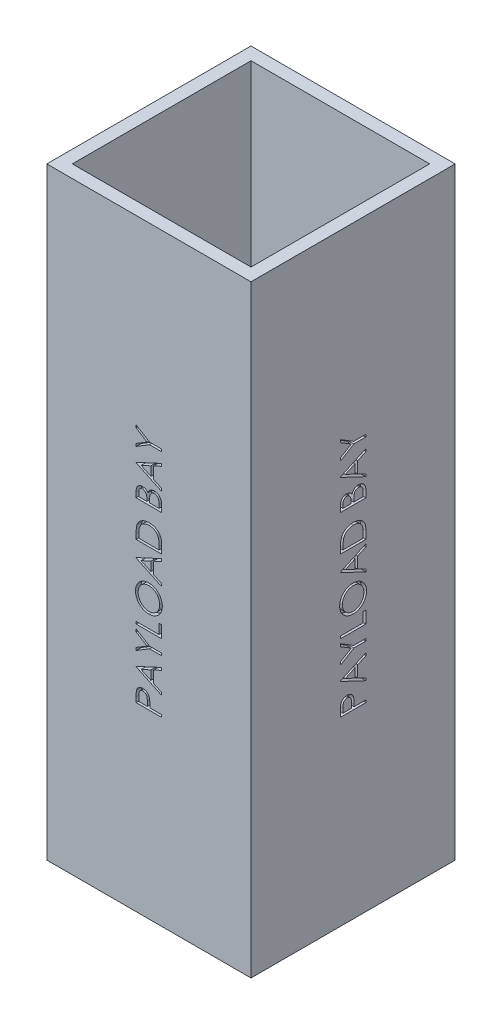
from build123d import *

# Parameters (mm, degrees)
SKETCH1_W           = 101.6
SKETCH1_H           = 101.6
SKETCH1_W_2         = 88.9
SKETCH1_H_2         = 88.9
BOSS_EXTRUDE1_DEPTH = 300
CUT_EXTRUDE1_DEPTH  = 2.54
CIRPATTERN1_COUNT   = 4


with BuildPart() as part:
    # Sketch1 → Boss-Extrude1 (new body)
    with BuildSketch(Plane(origin=(0, 0, 0), x_dir=(1, 0, 0), z_dir=(0, 1, 0))):
        Rectangle(SKETCH1_W, SKETCH1_H)
        Rectangle(SKETCH1_W_2, SKETCH1_H_2, mode=Mode.SUBTRACT)
    extrude(amount=BOSS_EXTRUDE1_DEPTH)

    # Sketch6 → Cut-Extrude1 (cut)
    # profile 1 of 10: a face of its own
    with BuildSketch(Plane.ZY.offset(50.8)):
        with BuildLine():
            Line((-6.35, 90.082051282), (-6.35, 92.572696314))
            add(Edge.make_bspline(
                [(-6.35, 92.572696314), (-6.349811691, 92.744004459), (-6.349450882, 93.072238473), (-6.338511661, 93.542918818), (-6.323900522, 93.970399844), (-6.303646223, 94.353759798), (-6.279710024, 94.694178211), (-6.246138339, 94.990114698), (-6.211085266, 95.243895374), (-6.175447591, 95.395955919), (-6.159194712, 95.465304487)],
                knots=[0, 0, 0, 0, 1.415646017, 2.712440637, 3.8905458, 4.950247383, 5.884950622, 6.709939814, 7.411656543, 8, 8, 8, 8], degree=3))
            add(Edge.make_bspline(
                [(-6.159194712, 95.465304487), (-6.135165553, 95.553091687), (-6.087673454, 95.726597491), (-5.99256869, 95.976620926), (-5.879734333, 96.214446609), (-5.751382729, 96.441136022), (-5.601195819, 96.652560376), (-5.439164902, 96.855767619), (-5.254818851, 97.043584549), (-5.053971996, 97.218555122), (-4.839171698, 97.380275569), (-4.60651531, 97.516149986), (-4.36294889, 97.634954344), (-4.105162168, 97.732225501), (-3.832904869, 97.804560375), (-3.548111823, 97.858261731), (-3.250462794, 97.892503698), (-3.047042823, 97.895772087), (-2.943489583, 97.897435897)],
                knots=[0, 0, 0, 0, 0.999549623, 1.97554611, 2.93413192, 3.889860808, 4.833293765, 5.780583482, 6.742559327, 7.719844669, 8.705620613, 9.691528643, 10.674968152, 11.680406189, 12.713313868, 13.765869198, 14.862690416, 16, 16, 16, 16], degree=3))
            add(Edge.make_bspline(
                [(-2.943489583, 97.897435897), (-2.839067365, 97.895906728), (-2.634758241, 97.892914804), (-2.335862696, 97.857005426), (-2.050227394, 97.808635873), (-1.778485674, 97.734260855), (-1.522251307, 97.636849412), (-1.277608551, 97.522578249), (-1.048719455, 97.384752296), (-0.834753057, 97.226383914), (-0.635508519, 97.050210986), (-0.452429693, 96.856978896), (-0.286588236, 96.647467749), (-0.137612361, 96.422343383), (-0.008956718, 96.179411074), (0.106276931, 95.92235526), (0.20305478, 95.648941618), (0.25396386, 95.459738781), (0.279847756, 95.363541667)],
                knots=[0, 0, 0, 0, 1.121902311, 2.195077645, 3.232258892, 4.234102512, 5.217864754, 6.176164875, 7.132989551, 8.084763148, 9.034132444, 9.988522005, 10.94243251, 11.903244335, 12.886203696, 13.894208494, 14.929344452, 16, 16, 16, 16], degree=3))
            add(Edge.make_bspline(
                [(0.279847756, 95.363541667), (0.296755106, 95.283975863), (0.333808547, 95.109602778), (0.375455577, 94.822445764), (0.409610691, 94.48794002), (0.441484518, 94.107223684), (0.458373661, 93.679408932), (0.47820427, 93.205476968), (0.487561251, 92.683823846), (0.488152728, 92.319987058), (0.488461538, 92.130028045)],
                knots=[0, 0, 0, 0, 0.601372724, 1.317943291, 2.144091499, 3.08771165, 4.142394186, 5.309582461, 6.595334295, 8, 8, 8, 8], degree=3))
            Line((0.488461538, 92.130028045), (0.488461538, 91.221794872))
            Line((0.488461538, 91.221794872), (6.35, 91.221794872))
            Line((6.35, 91.221794872), (6.35, 90.082051282))
            Line((6.35, 90.082051282), (-6.35, 90.082051282))
        make_face()
        with BuildLine():
            Line((-5.047435897, 91.221794872), (-0.814102564, 91.221794872))
            Line((-0.814102564, 91.221794872), (-0.786117788, 93.4453125))
            add(Edge.make_bspline(
                [(-0.786117788, 93.4453125), (-0.786058006, 93.553879847), (-0.785942597, 93.763466872), (-0.800452377, 94.066211014), (-0.816979073, 94.347130601), (-0.841974741, 94.605169257), (-0.874740105, 94.84123239), (-0.915487111, 95.053280991), (-0.959785588, 95.244486591), (-1.033797354, 95.464431594), (-1.147598039, 95.711657023), (-1.313260324, 95.981731934), (-1.527867901, 96.208844847), (-1.768488369, 96.40501689), (-2.035447832, 96.563756171), (-2.322580965, 96.675740401), (-2.62563392, 96.744695668), (-2.832880378, 96.75330752), (-2.938401442, 96.757692308)],
                knots=[0, 0, 0, 0, 1.160746174, 2.240796558, 3.240300023, 4.169675897, 5.012224395, 5.787635701, 6.478238024, 7.109103438, 8.265591281, 9.382545711, 10.479929969, 11.588830844, 12.694575677, 13.785760505, 14.872603606, 16, 16, 16, 16], degree=3))
            add(Edge.make_bspline(
                [(-2.938401442, 96.757692308), (-3.040503948, 96.753110659), (-3.243471094, 96.744002909), (-3.540938354, 96.676309447), (-3.824816581, 96.562553668), (-4.089626181, 96.404878111), (-4.329717186, 96.21346686), (-4.538638533, 95.991169219), (-4.705467251, 95.737416482), (-4.81729303, 95.503335586), (-4.882763075, 95.293719024), (-4.930049703, 95.112545142), (-4.962657093, 94.906933975), (-4.993858298, 94.678839141), (-5.019043897, 94.428550238), (-5.036533738, 94.154476492), (-5.046662216, 93.857530593), (-5.04717176, 93.651390347), (-5.047435897, 93.54453125)],
                knots=[0, 0, 0, 0, 1.120540835, 2.227496496, 3.330685923, 4.466139262, 5.598993257, 6.692710361, 7.80064471, 8.921224235, 9.527843361, 10.209888745, 10.975318552, 11.811557897, 12.738105936, 13.73658638, 14.826690375, 16, 16, 16, 16], degree=3))
            Line((-5.047435897, 93.54453125), (-5.047435897, 91.221794872))
        make_face(mode=Mode.SUBTRACT)
    # profile 2 of 10: a face of its own
    with BuildSketch(Plane.ZY.offset(50.8)):
        Polygon((-6.35, 105.712820513), (6.35, 111.574358974), (6.35, 110.335396635), (2.279487179, 108.457872596), (2.279487179, 102.700641026), (6.35, 100.769691506), (6.35, 99.525641026), (-6.35, 105.55), align=None)
        Polygon((-3.874619391, 105.618689904), (0.976923077, 103.31885016), (0.976923077, 107.857471955), align=None, mode=Mode.SUBTRACT)
    # profile 3 of 10: a face of its own
    with BuildSketch(Plane.ZY.offset(50.8)):
        Polygon((-6.35, 112.551282051), (-6.35, 113.856390224), (-0.89296875, 117.194210737), (-6.35, 120.526943109), (-6.35, 121.832051282), (0.312920673, 117.761538462), (6.35, 117.761538462), (6.35, 116.621794872), (0.312920673, 116.621794872), align=None)
    # profile 4 of 10: a face of its own
    with BuildSketch(Plane.ZY.offset(50.8)):
        Polygon((-6.35, 123.948717949), (-6.35, 125.088461538), (5.047435897, 125.088461538), (5.047435897, 129.973076923), (6.35, 129.973076923), (6.35, 123.948717949), align=None)
    # profile 5 of 10: a face of its own
    with BuildSketch(Plane.ZY.offset(50.8)):
        with BuildLine():
            add(Edge.make_bspline(
                [(-6.675641026, 138.032692308), (-6.669785071, 138.267878789), (-6.658283492, 138.729804442), (-6.567334124, 139.408062537), (-6.41764098, 140.057525074), (-6.206242297, 140.678565423), (-5.932190469, 141.268821615), (-5.599295982, 141.829960687), (-5.205535771, 142.360300963), (-4.756691829, 142.856191897), (-4.26513446, 143.308559312), (-3.738912975, 143.705514067), (-3.184643364, 144.040382863), (-2.60229672, 144.314509446), (-1.99323266, 144.529716981), (-1.354037691, 144.678184212), (-0.688898346, 144.77303121), (-0.235229152, 144.784118924), (-0.005088141, 144.78974359)],
                knots=[0, 0, 0, 0, 1.065064174, 2.09187391, 3.093564831, 4.079973196, 5.057907931, 6.036227367, 7.030399151, 8.044883615, 9.061699972, 10.052012555, 11.025713132, 11.989727027, 12.962874294, 13.945865945, 14.957962116, 16, 16, 16, 16], degree=3))
            add(Edge.make_bspline(
                [(-0.005088141, 144.78974359), (0.223356266, 144.784117031), (0.673646657, 144.773026431), (1.334584132, 144.678107253), (1.969850898, 144.529054513), (2.578031024, 144.317174008), (3.159194899, 144.042837073), (3.71388411, 143.707475299), (4.241511135, 143.311273919), (4.736454933, 142.860827488), (5.189213913, 142.368333696), (5.588564969, 141.844134632), (5.923579539, 141.2898798), (6.200766497, 140.711312922), (6.411489139, 140.103890905), (6.56490218, 139.472033968), (6.658807614, 138.812299547), (6.669968316, 138.362882653), (6.675641026, 138.134455128)],
                knots=[0, 0, 0, 0, 1.043748596, 2.057349401, 3.045489418, 4.02252776, 4.995289225, 5.97782527, 6.980224157, 8.006516136, 9.032559198, 10.034193337, 11.013412982, 11.987833483, 12.961212594, 13.946489799, 14.956251404, 16, 16, 16, 16], degree=3))
            add(Edge.make_bspline(
                [(6.675641026, 138.134455128), (6.670018965, 137.904315456), (6.658936386, 137.450648902), (6.563935289, 136.784671659), (6.415376844, 136.145035274), (6.203071175, 135.533568914), (5.928688652, 134.949931598), (5.594118477, 134.392981869), (5.19712685, 133.864955249), (4.746579565, 133.370229483), (4.256099934, 132.917568107), (3.730558494, 132.522926944), (3.180265837, 132.188281533), (2.603694821, 131.914820298), (2.003632729, 131.698323545), (1.376076825, 131.550623205), (0.724604903, 131.455061322), (0.281037815, 131.444049165), (0.055969551, 131.438461538)],
                knots=[0, 0, 0, 0, 1.053102029, 2.075944431, 3.073151272, 4.055350789, 5.033113405, 6.020478099, 7.024410459, 8.052272461, 9.079885166, 10.07527673, 11.055994387, 12.023226415, 12.992069828, 13.970394897, 14.97016774, 16, 16, 16, 16], degree=3))
            add(Edge.make_bspline(
                [(0.055969551, 131.438461538), (-0.095097562, 131.440401502), (-0.395326011, 131.444256954), (-0.841156245, 131.490672524), (-1.279816632, 131.558024983), (-1.710059786, 131.654551923), (-2.130832502, 131.780795971), (-2.545036699, 131.929756185), (-2.948474782, 132.111692195), (-3.343057946, 132.317361975), (-3.722635205, 132.546911965), (-4.081426835, 132.800461113), (-4.422443595, 133.069103735), (-4.736848437, 133.363610906), (-5.033787705, 133.674276293), (-5.308698135, 134.006139551), (-5.564058671, 134.357175695), (-5.794183909, 134.728895187), (-6.002315626, 135.112138642), (-6.180920628, 135.507205807), (-6.33421348, 135.908731081), (-6.45845876, 136.318595089), (-6.556546433, 136.735709433), (-6.623338831, 137.16098448), (-6.669872784, 137.594081427), (-6.673710006, 137.885859641), (-6.675641026, 138.032692308)],
                knots=[0, 0, 0, 0, 1.037015668, 2.060948919, 3.074880161, 4.083647147, 5.086022904, 6.090072063, 7.104153813, 8.122640571, 9.144368836, 10.147691507, 11.138137339, 12.123020368, 13.103399296, 14.087645067, 15.080126199, 16.082011238, 17.087798457, 18.072939717, 19.057185487, 20.037253025, 21.01195951, 21.997135196, 22.992090687, 24, 24, 24, 24], degree=3))
        make_face()
        with BuildLine():
            add(Edge.make_bspline(
                [(-5.373076923, 138.088661859), (-5.371612874, 137.968138647), (-5.368698771, 137.728244435), (-5.330103131, 137.371634762), (-5.275488499, 137.019606801), (-5.196168901, 136.672841773), (-5.093572448, 136.330612447), (-4.969833028, 135.992766886), (-4.820275395, 135.660463451), (-4.652079665, 135.334117284), (-4.461036223, 135.021265912), (-4.258166746, 134.721155899), (-4.035933534, 134.441593359), (-3.799142721, 134.178737887), (-3.545739327, 133.933243177), (-3.277387483, 133.705217516), (-2.992926494, 133.494847893), (-2.693527038, 133.304666015), (-2.380860728, 133.135418989), (-2.060904396, 132.983885031), (-1.729897889, 132.858269162), (-1.389906788, 132.758762678), (-1.042429358, 132.674304473), (-0.685572416, 132.621326036), (-0.320566176, 132.582350109), (-0.073887757, 132.579597426), (0.05088141, 132.578205128)],
                knots=[0, 0, 0, 0, 1.008406545, 2.007172654, 2.999155034, 3.989332444, 4.982025741, 5.988181096, 6.998684226, 8.030553839, 9.059268815, 10.065399129, 11.060956322, 12.046057109, 13.024974577, 14.012068307, 14.991706172, 15.984221787, 16.978487447, 17.966117052, 18.945677757, 19.938371053, 20.93015022, 21.936155317, 22.956113857, 24, 24, 24, 24], degree=3))
            add(Edge.make_bspline(
                [(0.05088141, 132.578205128), (0.234345869, 132.58284164), (0.595277215, 132.591963092), (1.124266852, 132.671486696), (1.63314324, 132.794954947), (2.118873279, 132.973960588), (2.583622971, 133.202317606), (3.025583679, 133.480866807), (3.444625029, 133.812159116), (3.837627676, 134.188256745), (4.19619396, 134.599509589), (4.511375607, 135.035990281), (4.776641272, 135.494245547), (4.998397407, 135.971634123), (5.165459253, 136.47223187), (5.284574271, 136.992829147), (5.361776101, 137.533437463), (5.369274234, 137.901830698), (5.373076923, 138.088661859)],
                knots=[0, 0, 0, 0, 1.032022337, 2.030307203, 3.003823408, 3.974715386, 4.937372378, 5.913284036, 6.909147208, 7.938749767, 8.970518239, 9.975863271, 10.963918693, 11.946286286, 12.933361397, 13.927862637, 14.949112547, 16, 16, 16, 16], degree=3))
            add(Edge.make_bspline(
                [(5.373076923, 138.088661859), (5.371352914, 138.214245402), (5.367933685, 138.463315285), (5.333446658, 138.833768939), (5.278253288, 139.197582943), (5.198393676, 139.554085094), (5.099767851, 139.903742487), (4.97743268, 140.245500082), (4.830782133, 140.579244366), (4.667344949, 140.906616436), (4.481684714, 141.220286113), (4.281550104, 141.518575726), (4.063238117, 141.797656623), (3.829627504, 142.060388767), (3.57700307, 142.304162974), (3.310282099, 142.5315394), (3.025217373, 142.738271673), (2.727044186, 142.927808831), (2.416657403, 143.099120929), (2.095821442, 143.246271725), (1.766257055, 143.371941549), (1.427722103, 143.473245665), (1.080978091, 143.552668472), (0.725528754, 143.607384366), (0.362093818, 143.645660851), (0.116280345, 143.648545747), (-0.007632212, 143.65)],
                knots=[0, 0, 0, 0, 1.047334373, 2.07717862, 3.100662057, 4.115010574, 5.122652213, 6.129548646, 7.140165612, 8.16200981, 9.179904151, 10.178566626, 11.156366481, 12.133321541, 13.108841334, 14.082538371, 15.054589433, 16.043660176, 17.028268541, 18.009491307, 18.985652105, 19.968123554, 20.954864208, 21.950389976, 22.966808393, 24, 24, 24, 24], degree=3))
            add(Edge.make_bspline(
                [(-0.007632212, 143.65), (-0.130697041, 143.648544533), (-0.374818801, 143.645657346), (-0.735719484, 143.607403224), (-1.088609709, 143.552608564), (-1.432104078, 143.473641023), (-1.766290161, 143.37185904), (-2.090854054, 143.246356428), (-2.407005009, 143.098364107), (-2.713961172, 142.928516926), (-3.008510573, 142.737597379), (-3.290092515, 142.528972715), (-3.553442649, 142.299057084), (-3.804973342, 142.05435931), (-4.03965346, 141.788996329), (-4.256576238, 141.502921828), (-4.465515493, 141.203258692), (-4.650429047, 140.883230258), (-4.822051388, 140.554134185), (-4.968471586, 140.216134055), (-5.094225799, 139.874057007), (-5.196475173, 139.526535353), (-5.275184667, 139.173733358), (-5.330152005, 138.815856192), (-5.368685515, 138.454153049), (-5.371608475, 138.210878865), (-5.373076923, 138.088661859)],
                knots=[0, 0, 0, 0, 1.029877221, 2.042951179, 3.035109885, 4.018542222, 4.991021277, 5.957494829, 6.929429462, 7.911425532, 8.892163142, 9.866273635, 10.842761649, 11.81676864, 12.802607151, 13.805177466, 14.821356543, 15.858816981, 16.897175917, 17.927346774, 18.940346092, 19.946830556, 20.957962087, 21.964146003, 22.97721996, 24, 24, 24, 24], degree=3))
        make_face(mode=Mode.SUBTRACT)
    # profile 6 of 10: a face of its own
    with BuildSketch(Plane.ZY.offset(50.8)):
        Polygon((-6.35, 152.605128205), (6.35, 158.466666667), (6.35, 157.227704327), (2.279487179, 155.350180288), (2.279487179, 149.592948718), (6.35, 147.661999199), (6.35, 146.417948718), (-6.35, 152.442307692), align=None)
        Polygon((-3.874619391, 152.510997596), (0.976923077, 150.211157853), (0.976923077, 154.749779647), align=None, mode=Mode.SUBTRACT)
    # profile 7 of 10: a face of its own
    with BuildSketch(Plane.ZY.offset(50.8)):
        with BuildLine():
            Line((6.35, 160.420512821), (-6.35, 160.420512821))
            Line((-6.35, 160.420512821), (-6.35, 162.984935897))
            add(Edge.make_bspline(
                [(-6.35, 162.984935897), (-6.348394103, 163.207980512), (-6.345291519, 163.638901546), (-6.325619614, 164.26160957), (-6.290819923, 164.837767793), (-6.2401305, 165.365481311), (-6.177889492, 165.846198851), (-6.099873739, 166.278574372), (-6.00775095, 166.664843576), (-5.929208887, 166.902404118), (-5.892067308, 167.01474359)],
                knots=[0, 0, 0, 0, 1.314313732, 2.53924729, 3.670748893, 4.714932338, 5.66265055, 6.526160246, 7.303039223, 8, 8, 8, 8], degree=3))
            add(Edge.make_bspline(
                [(-5.892067308, 167.01474359), (-5.836093327, 167.161694877), (-5.725414669, 167.452265085), (-5.51631439, 167.865755961), (-5.280367806, 168.256337905), (-5.012145128, 168.620896847), (-4.715148895, 168.96034751), (-4.391500844, 169.278542555), (-4.034011275, 169.56763688), (-3.649043287, 169.832133132), (-3.241529407, 170.070675187), (-2.812137035, 170.27800451), (-2.363076518, 170.450195854), (-1.895588611, 170.593136678), (-1.408647571, 170.705791053), (-0.9016858, 170.782651182), (-0.376707035, 170.833345923), (-0.02047398, 170.838440622), (0.160276442, 170.841025641)],
                knots=[0, 0, 0, 0, 0.984741985, 1.947153288, 2.898543998, 3.841229145, 4.778974371, 5.722123648, 6.681464302, 7.655713756, 8.646344578, 9.637374342, 10.639946623, 11.656849581, 12.698333139, 13.76849723, 14.867749466, 16, 16, 16, 16], degree=3))
            add(Edge.make_bspline(
                [(0.160276442, 170.841025641), (0.317252935, 170.838743386), (0.626591509, 170.834245964), (1.082488494, 170.793862471), (1.52486052, 170.735165446), (1.951601475, 170.644291121), (2.366448593, 170.533972212), (2.764986355, 170.392592467), (3.150849201, 170.230613026), (3.518898525, 170.041806471), (3.867366737, 169.834246367), (4.196106488, 169.612889743), (4.497822934, 169.372716402), (4.780422415, 169.120834747), (5.036355603, 168.851170688), (5.270287817, 168.567007346), (5.478302523, 168.267240384), (5.663668473, 167.950014161), (5.829436114, 167.61109204), (5.967706215, 167.239813205), (6.087462238, 166.837936329), (6.182728161, 166.40316961), (6.259560811, 165.937063728), (6.310716285, 165.438325694), (6.345409359, 164.907898054), (6.348440074, 164.543663461), (6.35, 164.356189904)],
                knots=[0, 0, 0, 0, 1.106010661, 2.179509527, 3.223302912, 4.248870533, 5.252098245, 6.246278179, 7.226402005, 8.199283979, 9.158616973, 10.083547221, 10.989831858, 11.874256832, 12.749262829, 13.607058236, 14.46581075, 15.317568432, 16.194266721, 17.121067875, 18.106207572, 19.147242834, 20.255495536, 21.43354536, 22.679031616, 24, 24, 24, 24], degree=3))
            Line((6.35, 164.356189904), (6.35, 160.420512821))
        make_face()
        with BuildLine():
            Line((5.047435897, 161.56025641), (5.047435897, 163.018008814))
            add(Edge.make_bspline(
                [(5.047435897, 163.018008814), (5.046535662, 163.227480331), (5.04480418, 163.630370771), (5.029610614, 164.209701218), (5.004784155, 164.739035028), (4.970040301, 165.218447362), (4.924071326, 165.647667536), (4.872818108, 166.027592571), (4.808964501, 166.35697708), (4.751085305, 166.556292466), (4.724338942, 166.648397436)],
                knots=[0, 0, 0, 0, 1.375205317, 2.645023457, 3.804390687, 4.853969522, 5.800190428, 6.637939096, 7.370582563, 8, 8, 8, 8], degree=3))
            add(Edge.make_bspline(
                [(4.724338942, 166.648397436), (4.683511867, 166.764324362), (4.602832871, 166.993409301), (4.45566639, 167.323177636), (4.281342714, 167.630725124), (4.087567265, 167.921407724), (3.867514454, 168.191116069), (3.625936061, 168.442993512), (3.36172837, 168.676731682), (3.075319806, 168.888730377), (2.769816125, 169.080752404), (2.444677018, 169.245595261), (2.104473453, 169.389151793), (1.746451287, 169.502822569), (1.373234633, 169.592446996), (0.9828882, 169.655268709), (0.575757403, 169.694269377), (0.298593328, 169.698919006), (0.157732372, 169.701282051)],
                knots=[0, 0, 0, 0, 0.998590647, 1.973329978, 2.929871262, 3.868367705, 4.809062953, 5.754642869, 6.701828697, 7.672172887, 8.647399344, 9.630604387, 10.631475358, 11.644913558, 12.679592956, 13.747988925, 14.855477812, 16, 16, 16, 16], degree=3))
            add(Edge.make_bspline(
                [(0.157732372, 169.701282051), (0.009202315, 169.699419551), (-0.282586297, 169.695760654), (-0.710723963, 169.649771013), (-1.122496609, 169.582564226), (-1.517931775, 169.485377708), (-1.897800939, 169.361531376), (-2.260003161, 169.206973676), (-2.608363686, 169.030383372), (-2.934842098, 168.820276978), (-3.243608523, 168.590168968), (-3.526473502, 168.334797806), (-3.784081392, 168.058220695), (-4.020444041, 167.763454241), (-4.226052236, 167.442191052), (-4.409972479, 167.101999089), (-4.566058713, 166.737887653), (-4.649076301, 166.4845673), (-4.691266026, 166.355829327)],
                knots=[0, 0, 0, 0, 1.122418816, 2.205001699, 3.251619955, 4.274784885, 5.280384055, 6.268708349, 7.249350384, 8.229342522, 9.199999885, 10.157847722, 11.105861043, 12.055065948, 13.010012805, 13.98527497, 14.976112212, 16, 16, 16, 16], degree=3))
            add(Edge.make_bspline(
                [(-4.691266026, 166.355829327), (-4.720717064, 166.249326596), (-4.783338052, 166.022872568), (-4.851647261, 165.653340799), (-4.911897871, 165.237451542), (-4.962908471, 164.773358341), (-4.999511037, 164.261590218), (-5.026984093, 163.701753579), (-5.045513874, 163.093606442), (-5.046779183, 162.672029819), (-5.047435897, 162.45322516)],
                knots=[0, 0, 0, 0, 0.674548936, 1.434276114, 2.292660221, 3.240891867, 4.284742987, 5.42552168, 6.663806718, 8, 8, 8, 8], degree=3))
            Line((-5.047435897, 162.45322516), (-5.047435897, 161.56025641))
            Line((-5.047435897, 161.56025641), (5.047435897, 161.56025641))
        make_face(mode=Mode.SUBTRACT)
    # profile 8 of 10: a face of its own
    with BuildSketch(Plane.ZY.offset(50.8)):
        with BuildLine():
            Line((-6.35, 178.330769231), (-6.35, 180.80869391))
            add(Edge.make_bspline(
                [(-6.35, 180.80869391), (-6.349372317, 180.929993444), (-6.34815571, 181.165102129), (-6.32884905, 181.506958107), (-6.303182672, 181.827265278), (-6.260128703, 182.125457622), (-6.215487417, 182.40347543), (-6.149964695, 182.658496238), (-6.077592462, 182.892656163), (-5.966237959, 183.173834305), (-5.793303013, 183.492869434), (-5.536824054, 183.835772502), (-5.229326494, 184.133844772), (-4.878908769, 184.387294554), (-4.493409562, 184.590693397), (-4.081123013, 184.735981885), (-3.64898535, 184.829320743), (-3.352715027, 184.838799389), (-3.202984776, 184.843589744)],
                knots=[0, 0, 0, 0, 1.00128172, 1.940733171, 2.826250472, 3.653024905, 4.427672124, 5.149348099, 5.824709082, 6.450061444, 7.643590664, 8.808605388, 9.972104426, 11.165284501, 12.367876273, 13.557044126, 14.765369432, 16, 16, 16, 16], degree=3))
            add(Edge.make_bspline(
                [(-3.202984776, 184.843589744), (-3.062737383, 184.839599728), (-2.787138031, 184.83175897), (-2.384737295, 184.757696306), (-2.002077719, 184.640148273), (-1.639486801, 184.47769215), (-1.303714203, 184.268376526), (-0.995800058, 184.017586986), (-0.727381826, 183.716265358), (-0.577377362, 183.490393651), (-0.501181891, 183.375661058)],
                knots=[0, 0, 0, 0, 1.044641374, 2.052818814, 3.038628718, 4.023282556, 5.005660861, 5.98021751, 6.974042014, 8, 8, 8, 8], degree=3))
            add(Edge.make_bspline(
                [(-0.501181891, 183.375661058), (-0.445773816, 183.519920678), (-0.339764444, 183.795925067), (-0.152634166, 184.17596648), (0.051636421, 184.502202218), (0.271263785, 184.781005131), (0.511490195, 185.018194242), (0.774267381, 185.223613728), (1.059380217, 185.401202875), (1.365780824, 185.552330012), (1.690871704, 185.671042262), (2.030682193, 185.75829412), (2.383909628, 185.809905491), (2.623616838, 185.816946074), (2.745052083, 185.820512821)],
                knots=[0, 0, 0, 0, 1.272586185, 2.434772614, 3.483318042, 4.437947805, 5.351807173, 6.25737843, 7.180033415, 8.1141739, 9.066731021, 10.025721652, 10.999834114, 12, 12, 12, 12], degree=3))
            add(Edge.make_bspline(
                [(2.745052083, 185.820512821), (2.869029524, 185.81696904), (3.112958611, 185.809996552), (3.471291465, 185.758532445), (3.813764183, 185.671454355), (4.142434121, 185.551303705), (4.456612174, 185.395568463), (4.755160179, 185.203304589), (5.038699261, 184.977211083), (5.307729832, 184.721688874), (5.553901262, 184.436929363), (5.765525674, 184.123106054), (5.947492508, 183.788816177), (6.095643415, 183.429786154), (6.209941742, 183.046932515), (6.289576238, 182.640468299), (6.343323875, 182.211062893), (6.347736865, 181.916385354), (6.35, 181.765264423)],
                knots=[0, 0, 0, 0, 0.978680899, 1.925582087, 2.851223405, 3.764209995, 4.683484765, 5.614004905, 6.562443559, 7.542772147, 8.539900013, 9.527881485, 10.525548727, 11.540192123, 12.58875426, 13.674701727, 14.807505862, 16, 16, 16, 16], degree=3))
            Line((6.35, 181.765264423), (6.35, 178.330769231))
            Line((6.35, 178.330769231), (-6.35, 178.330769231))
        make_face()
        with BuildLine():
            Line((-5.047435897, 179.470512821), (-0.976923077, 179.470512821))
            Line((-0.976923077, 179.470512821), (-0.976923077, 180.236278045))
            add(Edge.make_bspline(
                [(-0.976923077, 180.236278045), (-0.978374226, 180.348215103), (-0.981178141, 180.564500309), (-0.989210049, 180.877718217), (-1.011700083, 181.168457579), (-1.034183694, 181.43621648), (-1.070739951, 181.680573468), (-1.114254566, 181.900986513), (-1.160274294, 182.100916987), (-1.238545357, 182.331469368), (-1.354184303, 182.593027832), (-1.533820739, 182.871677561), (-1.747610778, 183.118470549), (-1.996602328, 183.324374206), (-2.267797908, 183.494378417), (-2.558816675, 183.613471713), (-2.863802254, 183.692867668), (-3.073579537, 183.700149172), (-3.180088141, 183.703846154)],
                knots=[0, 0, 0, 0, 1.156917035, 2.235399477, 3.236897345, 4.169954739, 5.01148057, 5.788325709, 6.491867502, 7.129259015, 8.302032419, 9.437271567, 10.542795419, 11.662606952, 12.764338259, 13.836858145, 14.901724648, 16, 16, 16, 16], degree=3))
            add(Edge.make_bspline(
                [(-3.180088141, 183.703846154), (-3.250585181, 183.701969054), (-3.388872822, 183.698286917), (-3.591119209, 183.667034672), (-3.781156629, 183.61639774), (-3.960808966, 183.547821684), (-4.125611427, 183.454136614), (-4.283438701, 183.34554331), (-4.424837705, 183.211469459), (-4.556615938, 183.059954103), (-4.674557016, 182.886593511), (-4.77225292, 182.687652627), (-4.860797869, 182.468274376), (-4.926345062, 182.222506905), (-4.983983541, 181.955442602), (-5.020198184, 181.663465315), (-5.043502651, 181.348425244), (-5.046095572, 181.130142044), (-5.047435897, 181.017307692)],
                knots=[0, 0, 0, 0, 0.911708768, 1.788416306, 2.640049961, 3.452993646, 4.268229297, 5.087074648, 5.92553149, 6.781184137, 7.681934069, 8.628939405, 9.643570426, 10.73771997, 11.914765019, 13.176320755, 14.540391495, 16, 16, 16, 16], degree=3))
            Line((-5.047435897, 181.017307692), (-5.047435897, 179.470512821))
        make_face(mode=Mode.SUBTRACT)
        with BuildLine():
            Line((0.325641026, 179.470512821), (5.047435897, 179.470512821))
            Line((5.047435897, 179.470512821), (5.047435897, 181.093629808))
            add(Edge.make_bspline(
                [(5.047435897, 181.093629808), (5.045904986, 181.209800616), (5.042954355, 181.433704534), (5.036034513, 181.757237907), (5.009857802, 182.056320822), (4.985709904, 182.33189678), (4.944418036, 182.583234398), (4.905449249, 182.812266982), (4.847602867, 183.015234803), (4.768099821, 183.252754112), (4.640825315, 183.5182458), (4.454878463, 183.808380427), (4.225391341, 184.061373325), (3.964393202, 184.278544111), (3.681391572, 184.457762875), (3.380086158, 184.58636929), (3.066336778, 184.666289903), (2.852362575, 184.675933072), (2.745052083, 184.680769231)],
                knots=[0, 0, 0, 0, 1.160376723, 2.23647316, 3.230273494, 4.158083346, 4.997711197, 5.773399541, 6.476071462, 7.102777513, 8.27340052, 9.405620712, 10.53304798, 11.669441455, 12.787990954, 13.865552736, 14.929550474, 16, 16, 16, 16], degree=3))
            add(Edge.make_bspline(
                [(2.745052083, 184.680769231), (2.677946231, 184.679770435), (2.54481695, 184.677788953), (2.34920062, 184.647769991), (2.159617461, 184.604342067), (1.975277451, 184.547146241), (1.799280024, 184.467189559), (1.630950229, 184.369169369), (1.466897116, 184.256967846), (1.256812893, 184.083862119), (1.01776619, 183.828402227), (0.786615655, 183.465365211), (0.597190031, 183.054858428), (0.517108985, 182.756426067), (0.475741186, 182.602263622)],
                knots=[0, 0, 0, 0, 0.723302347, 1.434937762, 2.129609326, 2.821140842, 3.513216847, 4.209993937, 4.920569932, 5.655069131, 7.14393391, 8.6716197, 10.280644748, 12, 12, 12, 12], degree=3))
            add(Edge.make_bspline(
                [(0.475741186, 182.602263622), (0.463204167, 182.540472331), (0.436021324, 182.406496067), (0.407327657, 182.188028561), (0.381764154, 181.938615551), (0.362855097, 181.657681111), (0.343309639, 181.344869802), (0.33570843, 180.999513554), (0.326639687, 180.623022727), (0.325982428, 180.361793261), (0.325641026, 180.226101763)],
                knots=[0, 0, 0, 0, 0.634451884, 1.375622551, 2.216452059, 3.157844607, 4.20941857, 5.370758133, 6.634282058, 8, 8, 8, 8], degree=3))
            Line((0.325641026, 180.226101763), (0.325641026, 179.470512821))
        make_face(mode=Mode.SUBTRACT)
    # profile 9 of 10: a face of its own
    with BuildSketch(Plane.ZY.offset(50.8)):
        Polygon((-6.35, 193.635897436), (6.35, 199.497435897), (6.35, 198.258473558), (2.279487179, 196.380949519), (2.279487179, 190.623717949), (6.35, 188.692768429), (6.35, 187.448717949), (-6.35, 193.473076923), align=None)
        Polygon((-3.874619391, 193.541766827), (0.976923077, 191.241927083), (0.976923077, 195.780548878), align=None, mode=Mode.SUBTRACT)
    # profile 10 of 10: a face of its own
    with BuildSketch(Plane.ZY.offset(50.8)):
        Polygon((-6.35, 200.474358974), (-6.35, 201.779467147), (-0.89296875, 205.11728766), (-6.35, 208.450020032), (-6.35, 209.755128205), (0.312920673, 205.684615385), (6.35, 205.684615385), (6.35, 204.544871795), (0.312920673, 204.544871795), align=None)
    cut_extrude1 = extrude(amount=-CUT_EXTRUDE1_DEPTH, mode=Mode.SUBTRACT)

    # CirPattern1: Cut-Extrude1 ×4 about axis
    cirpattern1_axis = Axis((0, 0, 0), (0, 1, 0))
    for i in range(1, CIRPATTERN1_COUNT):
        add(cut_extrude1.rotate(cirpattern1_axis, i * 360 / CIRPATTERN1_COUNT), mode=Mode.SUBTRACT)


solid = part.part
